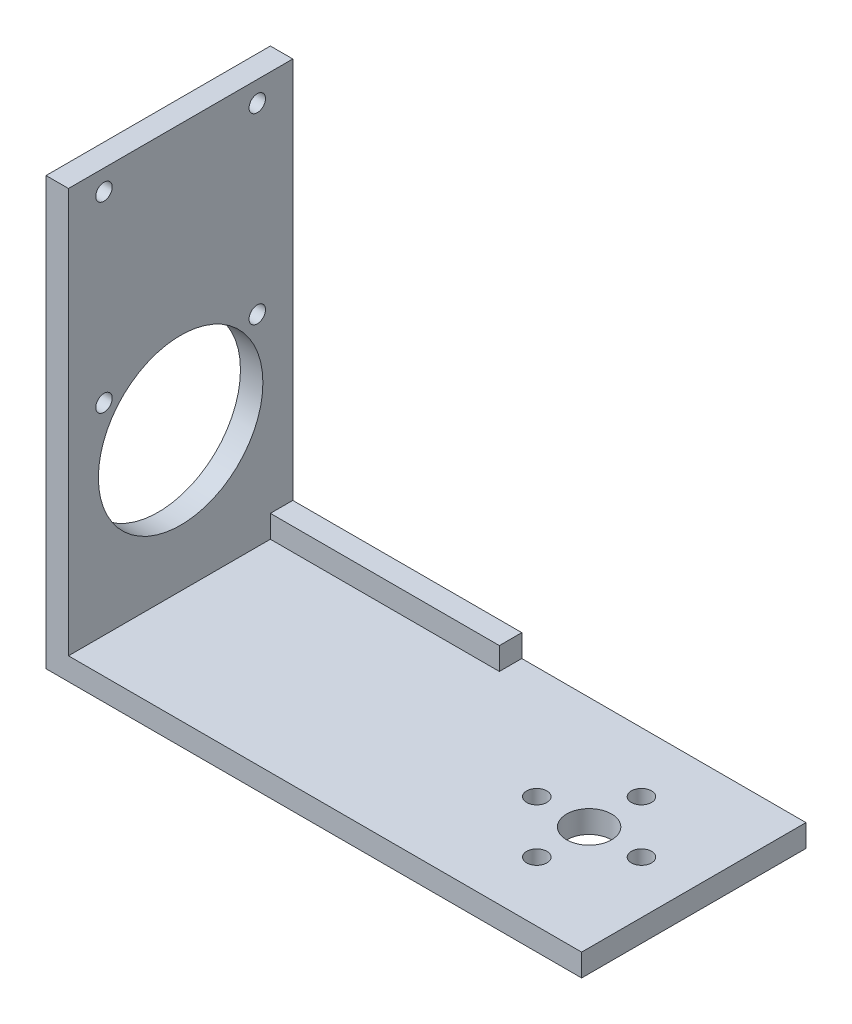
from build123d import *

# Parameters (mm, degrees)
S_BOX1_W      = 71.625
S_BOX1_H      = 3
BOSS_1_DEPTH  = 30
S_BOX2_W      = 3
S_BOX2_H      = 54.625
BOSS_2_DEPTH  = 30
S_BOX3_W      = 31.125
S_BOX3_H      = 3.5
BOSS_3_DEPTH  = 3
S_HOLE4_R     = 3
HOLE_4_DEPTH  = 3.2
S_HOLE5_R     = 1.35
HOLE_5_DEPTH  = 3.2
S_HOLE6_R     = 1.35
HOLE_6_DEPTH  = 3.2
S_HOLE7_R     = 1.35
HOLE_7_DEPTH  = 3.2
S_HOLE8_R     = 1.35
HOLE_8_DEPTH  = 3.2
S_HOLE9_R     = 11
HOLE_9_DEPTH  = 3.2
S_HOLE10_R    = 1.1
HOLE_10_DEPTH = 3.2
S_HOLE11_R    = 1.1
HOLE_11_DEPTH = 3.2
S_HOLE12_R    = 1.1
HOLE_12_DEPTH = 3.2
S_HOLE13_R    = 1.1
HOLE_13_DEPTH = 3.2


with BuildPart() as part:
    # S_box1 → Boss_1 (new body)
    with BuildSketch(Plane.XY.offset(-15)):
        with Locations((-21.8125, -20.125)):
            Rectangle(S_BOX1_W, S_BOX1_H)
    extrude(amount=BOSS_1_DEPTH)

    # S_box2 → Boss_2 (add)
    with BuildSketch(Plane.XY.offset(-15)):
        with Locations((-56.125, 8.1875)):
            Rectangle(S_BOX2_W, S_BOX2_H)
    extrude(amount=BOSS_2_DEPTH)

    # S_box3 → Boss_3 (add)
    with BuildSketch(Plane.XY.offset(-15)):
        with Locations((-39.5625, -17.375)):
            Rectangle(S_BOX3_W, S_BOX3_H)
    extrude(amount=BOSS_3_DEPTH)

    # S_hole4 → Hole_4 (cut)
    with BuildSketch(Plane(origin=(0, -21.725, 0), x_dir=(1, 0, 0), z_dir=(0, 1, 0))):
        Circle(S_HOLE4_R)
    extrude(amount=HOLE_4_DEPTH, mode=Mode.SUBTRACT)

    # S_hole5 → Hole_5 (cut)
    with BuildSketch(Plane(origin=(0, -21.725, 0), x_dir=(1, 0, 0), z_dir=(0, 1, 0))):
        with Locations((7, 0)):
            Circle(S_HOLE5_R)
    extrude(amount=HOLE_5_DEPTH, mode=Mode.SUBTRACT)

    # S_hole6 → Hole_6 (cut)
    with BuildSketch(Plane(origin=(0, -21.725, 0), x_dir=(1, 0, 0), z_dir=(0, 1, 0))):
        with Locations((0, -7)):
            Circle(S_HOLE6_R)
    extrude(amount=HOLE_6_DEPTH, mode=Mode.SUBTRACT)

    # S_hole7 → Hole_7 (cut)
    with BuildSketch(Plane(origin=(0, -21.725, 0), x_dir=(1, 0, 0), z_dir=(0, 1, 0))):
        with Locations((-7, 0)):
            Circle(S_HOLE7_R)
    extrude(amount=HOLE_7_DEPTH, mode=Mode.SUBTRACT)

    # S_hole8 → Hole_8 (cut)
    with BuildSketch(Plane(origin=(0, -21.725, 0), x_dir=(1, 0, 0), z_dir=(0, 1, 0))):
        with Locations((0, 7)):
            Circle(S_HOLE8_R)
    extrude(amount=HOLE_8_DEPTH, mode=Mode.SUBTRACT)

    # S_hole9 → Hole_9 (cut)
    with BuildSketch(Plane(origin=(-57.725, 0, 0), x_dir=(0, 0, -1), z_dir=(1, 0, 0))):
        Circle(S_HOLE9_R)
    extrude(amount=HOLE_9_DEPTH, mode=Mode.SUBTRACT)

    # S_hole10 → Hole_10 (cut)
    with BuildSketch(Plane(origin=(-57.725, 0, 0), x_dir=(0, 0, -1), z_dir=(1, 0, 0))):
        with Locations((10.25, 8.3)):
            Circle(S_HOLE10_R)
    extrude(amount=HOLE_10_DEPTH, mode=Mode.SUBTRACT)

    # S_hole11 → Hole_11 (cut)
    with BuildSketch(Plane(origin=(-57.725, 0, 0), x_dir=(0, 0, -1), z_dir=(1, 0, 0))):
        with Locations((-10.25, 8.3)):
            Circle(S_HOLE11_R)
    extrude(amount=HOLE_11_DEPTH, mode=Mode.SUBTRACT)

    # S_hole12 → Hole_12 (cut)
    with BuildSketch(Plane(origin=(-57.725, 0, 0), x_dir=(0, 0, -1), z_dir=(1, 0, 0))):
        with Locations((10.25, 32.75)):
            Circle(S_HOLE12_R)
    extrude(amount=HOLE_12_DEPTH, mode=Mode.SUBTRACT)

    # S_hole13 → Hole_13 (cut)
    with BuildSketch(Plane(origin=(-57.725, 0, 0), x_dir=(0, 0, -1), z_dir=(1, 0, 0))):
        with Locations((-10.25, 32.75)):
            Circle(S_HOLE13_R)
    extrude(amount=HOLE_13_DEPTH, mode=Mode.SUBTRACT)


solid = part.part
